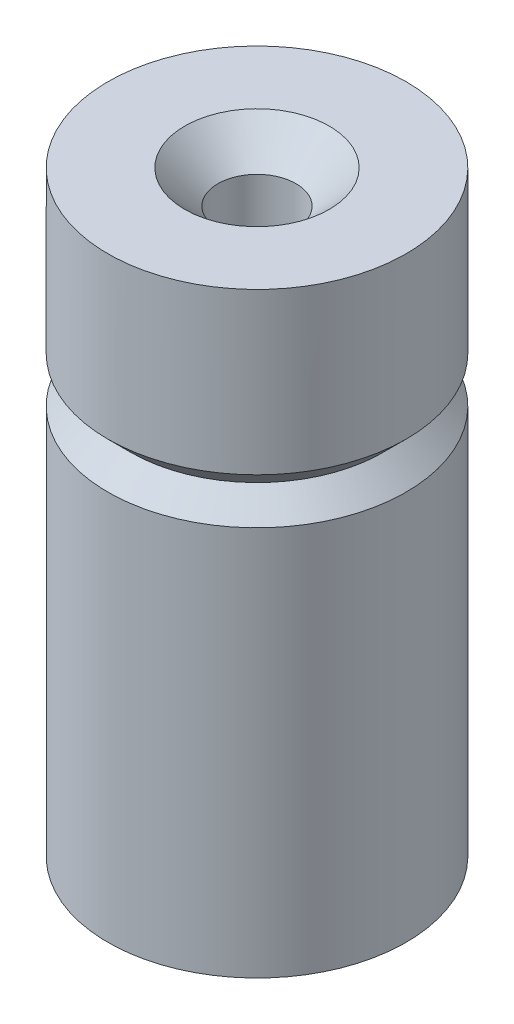
from build123d import *

# Parameters (mm, degrees)
SKETCH_1_R                  = 6.5
EXTRUDE_1_DEPTH             = 26
SKETCH_2_R                  = 2.85
CUT_EXTRUDE_1_DEPTH         = 3.5
HOLE_WIZARD_M32_D           = 3.4
HOLE_WIZARD_M32_CSINK_D     = 6.3
HOLE_WIZARD_M32_CSINK_ANGLE = 90


with BuildPart() as part:
    # Эскиз1 → Бобышка-Вытянуть1 (new body)
    with BuildSketch(Plane(origin=(0, 0, 0), x_dir=(1, 0, 0), z_dir=(0, 1, 0))):
        Circle(SKETCH_1_R)
    extrude(amount=EXTRUDE_1_DEPTH)

    # Эскиз2 → Вырез-Вытянуть1 (cut)
    with BuildSketch(Plane.XZ):
        Circle(SKETCH_2_R)
    extrude(amount=-CUT_EXTRUDE_1_DEPTH, mode=Mode.SUBTRACT)

    # Зенковка для  винта с плоской головкой M32 (through all)
    with Locations(Plane(origin=(0, 26, 0), x_dir=(1, 0, 0), z_dir=(0, 1, 0))):
        with Locations((0, 0)):
            CounterSinkHole(HOLE_WIZARD_M32_D / 2, HOLE_WIZARD_M32_CSINK_D / 2, counter_sink_angle=HOLE_WIZARD_M32_CSINK_ANGLE)

    # Вырез-По траектории2: sweep along a path in Эскиз5
    with BuildLine(Plane(origin=(0, 18, 0), x_dir=(-1, 0, 0), z_dir=(0, -1, 0))) as sweep_2_path:
        CenterArc((0, 0), 6.5, 0, 360)
    # Эскиз6 → Вырез-По траектории2 (sweep, cut)
    with BuildSketch(Plane(origin=(0, 0, 0), x_dir=(0, 0, -1), z_dir=(1, 0, 0))):
        Polygon((6.5, 19), (5.5, 18), (6.5, 17), align=None)
    sweep(path=sweep_2_path.line, mode=Mode.SUBTRACT)


solid = part.part
